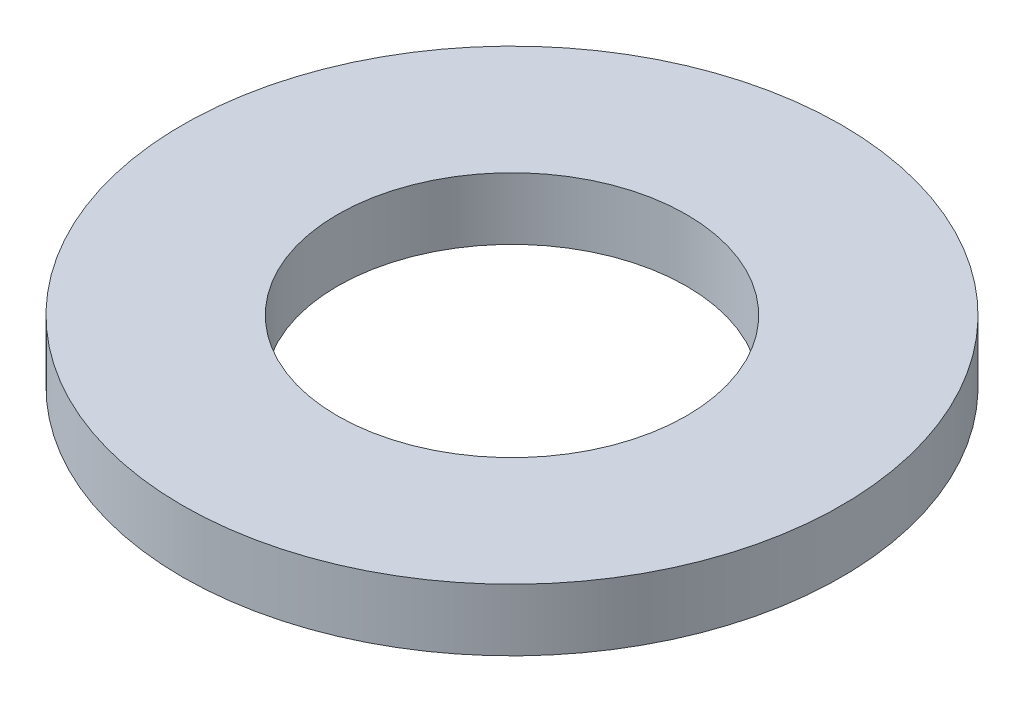
from build123d import *

# Parameters (mm, degrees)
BODYSKE_W = 4
BODYSKE_H = 1.6


with BuildPart() as part:
    # BodySke → BaseBody (revolve)
    with BuildSketch(Plane(origin=(0, 0, 0), x_dir=(1, 0, 0), z_dir=(0, 0, -1))):
        with Locations((6.5, 0.8)):
            Rectangle(BODYSKE_W, BODYSKE_H)
    revolve(axis=Axis((0, 0, 0), (0, -1, 0)))


solid = part.part
